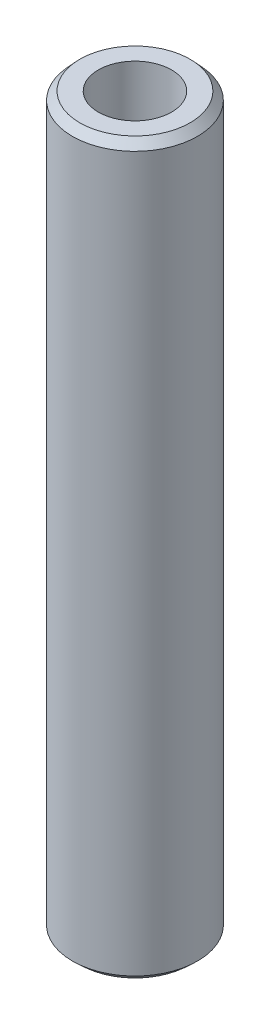
from build123d import *
from OCP.BRepFilletAPI import BRepFilletAPI_MakeChamfer

# Parameters (mm, degrees)
SKETCH1_R           = 37.5
BOSS_EXTRUDE1_DEPTH = 437.56160353
SKETCH2_R           = 21.96289277
CUT_EXTRUDE1_DEPTH  = 441.763720018
CHAMFER1_SIZE       = 4.828501584
CHAMFER1_SIZE2      = 4.443468371


with BuildPart() as part:
    # Sketch1 → Boss-Extrude1 (new body)
    with BuildSketch(Plane(origin=(0, 0, 0), x_dir=(1, 0, 0), z_dir=(0, 1, 0))):
        Circle(SKETCH1_R)
    extrude(amount=BOSS_EXTRUDE1_DEPTH)

    # Sketch2 → Cut-Extrude1 (cut, through all)
    with BuildSketch(Plane(origin=(0, 0, 0), x_dir=(1, 0, 0), z_dir=(0, 1, 0))):
        Circle(SKETCH2_R)
    extrude(amount=CUT_EXTRUDE1_DEPTH, mode=Mode.SUBTRACT)

    # Chamfer1: one chamfer whose edges measure the first distance from different faces: ONE call of the kernel's chamfer builder (chamfer() names one face for all edges)
    chamfer1_edges_1 = [part.edges().sort_by_distance(p)[0] for p in [
        (-37.5, 437.56160353, 0),
    ]]
    chamfer1_side_1 = [part.faces().sort_by_distance(p)[0] for p in [
        (-37.5, 218.780801765, 0),
    ]]
    chamfer1_edges_2 = [part.edges().sort_by_distance(p)[0] for p in [
        (-37.5, 0, 0),
    ]]
    chamfer1_side_2 = [part.faces().sort_by_distance(p)[0] for p in [
        (-36.439339828, 0, 0),
    ]]
    chamfer1 = BRepFilletAPI_MakeChamfer(part.part.solid().wrapped)
    for e in chamfer1_edges_1:
        chamfer1.Add(CHAMFER1_SIZE, CHAMFER1_SIZE2, e.wrapped, chamfer1_side_1[0].wrapped)  # the first distance lies on this face
    for e in chamfer1_edges_2:
        chamfer1.Add(CHAMFER1_SIZE, CHAMFER1_SIZE2, e.wrapped, chamfer1_side_2[0].wrapped)  # the first distance lies on this face
    add(Compound.cast(chamfer1.Shape()), mode=Mode.REPLACE)


solid = part.part
